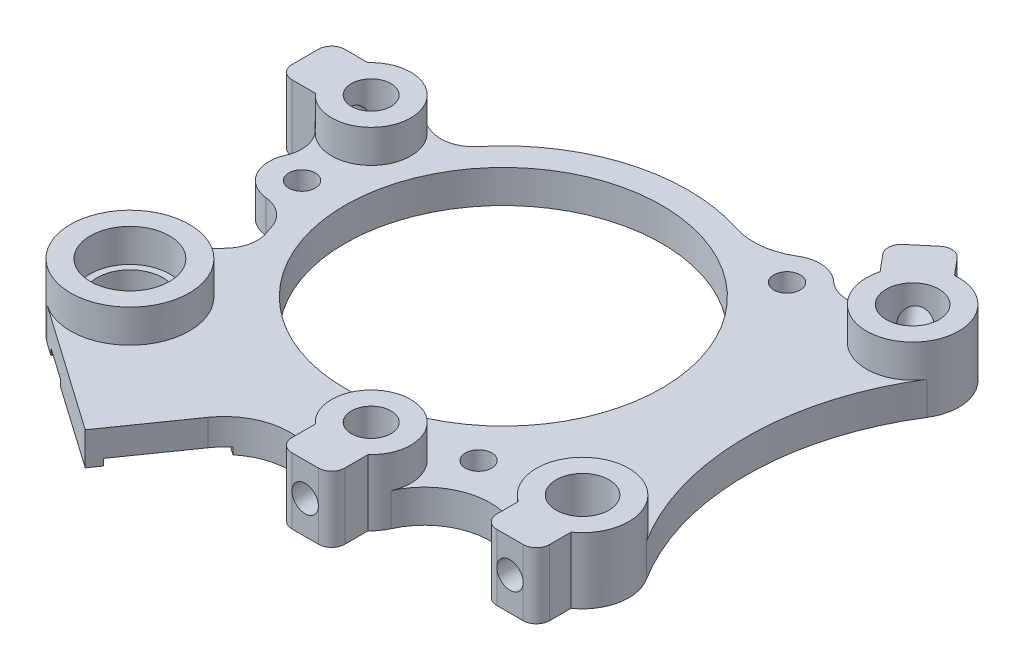
from build123d import *

# Parameters (mm, degrees)
SKETCH1_R               = 2
SKETCH1_R_2             = 3
SKETCH1_R_3             = 24
SKETCH1_R_4             = 4
SKETCH1_R_5             = 6
BOSS_EXTRUDE1_DEPTH     = 5
BOSS_EXTRUDE2_START     = 5
SKETCH2_R               = 6
SKETCH2_R_2             = 3
SKETCH2_R_3             = 9
SKETCH2_R_4             = 7
SKETCH2_R_5             = 4
BOSS_EXTRUDE2_DEPTH     = 5
SKETCH2_3_R             = 6
SKETCH2_3_R_2           = 5
BOSS_EXTRUDE3_DEPTH     = 5
CUT_EXTRUDE1_DEPTH      = 3.5
CUT_EXTRUDE2_START      = -1
SKETCH3_3_R             = 5
CUT_EXTRUDE2_DEPTH      = 1
SKETCH3_4_R             = 1
CUT_EXTRUDE3_DEPTH      = 4.99
BOSS_EXTRUDE4_START     = -10
BOSS_EXTRUDE4_DEPTH     = 10
CUT_EXTRUDE5_REACH      = 100.715
CUT_EXTRUDE5_END_RADIUS = 3
SKETCH5_R               = 2
CUT_EXTRUDE6_REACH      = 85.831
CUT_EXTRUDE6_END_RADIUS = 4
SKETCH8_R               = 2
CUT_EXTRUDE7_REACH      = 74.483
CUT_EXTRUDE7_END_RADIUS = 4
SKETCH7_R               = 2
CUT_EXTRUDE8_REACH      = 90.531
CUT_EXTRUDE8_END_RADIUS = 3
SKETCH6_R               = 2
FILLET1_R               = 10


with BuildPart() as part:
    # Sketch1 → Boss-Extrude1 (new body)
    with BuildSketch(Plane(origin=(0, 0, 0), x_dir=(1, 0, 0), z_dir=(0, 1, 0))):
        with BuildLine():
            Line((-27.184252213, 16.279325281), (-29.427581936, 17.095830526))
            ThreePointArc((-29.427581936, 17.095830526), (-36.458821852, 14.805565694), (-35.926828641, 7.429887354))
            ThreePointArc((-35.926828641, 7.429887354), (-34.695212118, 4.861149883), (-35.066383422, 2.036698907))
            ThreePointArc((-35.066383422, 2.036698907), (-34.820597735, -2.516433033), (-30.981557377, -4.976756222))
            ThreePointArc((-30.981557377, -4.976756222), (-28.317469736, -6.067007919), (-26.695976155, -8.445404498))
            ThreePointArc((-26.695976155, -8.445404498), (-26.517787426, -8.989268605), (-26.328520099, -9.529377177))
            ThreePointArc((-26.328520099, -9.529377177), (-26.149533562, -12.317625103), (-27.49450764, -14.766585578))
            Line((-27.49450764, -14.766585578), (-34.648232278, -21.920310217))
            ThreePointArc((-34.648232278, -21.920310217), (-37.25002353, -29.068672932), (-33.446459175, -35.656639646))
            Line((-33.446459175, -35.656639646), (-14.21846567, -49.120225643))
            Line((-14.21846567, -49.120225643), (-0.916023693, -30.122369648))
            ThreePointArc((-0.916023693, -30.122369648), (3.367217791, -32.328210757), (6.998677081, -35.494343419))
            ThreePointArc((6.998677081, -35.494343419), (12.390762018, -37.40670442), (16.93447098, -33.930152473))
            ThreePointArc((16.93447098, -33.930152473), (23.825671194, -28.267607379), (32.496308957, -30.358802757))
            ThreePointArc((32.496308957, -30.358802757), (41.596573655, -30.279347558), (42.927584732, -21.276595745))
            ThreePointArc((42.927584732, -21.276595745), (36.799497484, 0), (42.927584732, 21.276595745))
            ThreePointArc((42.927584732, 21.276595745), (40.519207625, 31.051047652), (30.832520912, 28.310921578))
            ThreePointArc((30.832520912, 28.310921578), (27.241849474, 25.742680837), (23.016100401, 27.020110539))
            ThreePointArc((23.016100401, 27.020110539), (20.102162754, 28.339579245), (16.984754776, 27.622782358))
            ThreePointArc((16.984754776, 27.622782358), (12.928437353, 26.210002133), (8.653635891, 26.629205506))
            ThreePointArc((8.653635891, 26.629205506), (-7.841377865, 26.879598084), (-21.614431573, 17.7993356))
            ThreePointArc((-21.614431573, 17.7993356), (-24.157783947, 16.154182216), (-27.184252213, 16.279325281))
        make_face()
        with Locations(Location((19.605022095, -23.364355515, 0), (0, 0, 270))):
            Circle(SKETCH1_R, mode=Mode.SUBTRACT)
        with Locations(Location((-30.5, 0, 0), (0, 0, 270))):
            Circle(SKETCH1_R, mode=Mode.SUBTRACT)
        with Locations(Location((-31.479702796, 11.457674801, 0), (0, 0, 270))):
            Circle(SKETCH1_R_2, mode=Mode.SUBTRACT)
        with Locations(Location((0, 0, 0), (0, 0, 270))):
            Circle(SKETCH1_R_3, mode=Mode.SUBTRACT)
        with Locations(Location((19.605022095, 23.364355515, 0), (0, 0, 270))):
            Circle(SKETCH1_R, mode=Mode.SUBTRACT)
        with Locations(Location((37, 25, 0), (0, 0, 270))):
            Circle(SKETCH1_R_4, mode=Mode.SUBTRACT)
        with Locations(Location((-28.284271247, -28.284271247, 0), (0, 0, 270))):
            Circle(SKETCH1_R_5, mode=Mode.SUBTRACT)
        with Locations(Location((37, -25, 0), (0, 0, 270))):
            Circle(SKETCH1_R_4, mode=Mode.SUBTRACT)
        with Locations(Location((11.457674801, -31.479702796, 0), (0, 0, 270))):
            Circle(SKETCH1_R_2, mode=Mode.SUBTRACT)
    extrude(amount=-BOSS_EXTRUDE1_DEPTH)

    # Sketch2 → Boss-Extrude2 (add)
    # profile 1 of 5: a face of its own
    with BuildSketch(Plane(origin=(0, 0, 0), x_dir=(1, 0, 0), z_dir=(0, 1, 0)).offset(BOSS_EXTRUDE2_START)):
        with Locations(Location((-31.479702796, 11.457674801, 0), (0, 0, 270))):
            Circle(SKETCH2_R)
        with Locations(Location((-31.479702796, 11.457674801, 0), (0, 0, 270))):
            Circle(SKETCH2_R_2, mode=Mode.SUBTRACT)
    # profile 2 of 5: a face of its own
    with BuildSketch(Plane(origin=(0, 0, 0), x_dir=(1, 0, 0), z_dir=(0, 1, 0)).offset(BOSS_EXTRUDE2_START)):
        with Locations(Location((-28.284271247, -28.284271247, 0), (0, 0, 270))):
            Circle(SKETCH2_R_3)
        with Locations(Location((-28.284271247, -28.284271247, 0), (0, 0, 270))):
            Circle(SKETCH2_R, mode=Mode.SUBTRACT)
    # profile 3 of 5: a face of its own
    with BuildSketch(Plane(origin=(0, 0, 0), x_dir=(1, 0, 0), z_dir=(0, 1, 0)).offset(BOSS_EXTRUDE2_START)):
        with Locations(Location((37, -25, 0), (0, 0, 270))):
            Circle(SKETCH2_R_4)
        with Locations(Location((37, -25, 0), (0, 0, 270))):
            Circle(SKETCH2_R_5, mode=Mode.SUBTRACT)
    # profile 4 of 5: a face of its own
    with BuildSketch(Plane(origin=(0, 0, 0), x_dir=(1, 0, 0), z_dir=(0, 1, 0)).offset(BOSS_EXTRUDE2_START)):
        with Locations(Location((11.457674801, -31.479702796, 0), (0, 0, 270))):
            Circle(SKETCH2_R)
        with Locations(Location((11.457674801, -31.479702796, 0), (0, 0, 270))):
            Circle(SKETCH2_R_2, mode=Mode.SUBTRACT)
    # profile 5 of 5: a face of its own
    with BuildSketch(Plane(origin=(0, 0, 0), x_dir=(1, 0, 0), z_dir=(0, 1, 0)).offset(BOSS_EXTRUDE2_START)):
        with Locations(Location((37, 25, 0), (0, 0, 270))):
            Circle(SKETCH2_R_4)
        with Locations(Location((37, 25, 0), (0, 0, 270))):
            Circle(SKETCH2_R_5, mode=Mode.SUBTRACT)
    extrude(amount=-BOSS_EXTRUDE2_DEPTH)

    # Sketch2<3> → Boss-Extrude3 (add)
    with BuildSketch(Plane(origin=(0, 0, 0), x_dir=(1, 0, 0), z_dir=(0, 1, 0))):
        with Locations(Location((-28.284271247, -28.284271247, 0), (0, 0, 270))):
            Circle(SKETCH2_3_R)
        with Locations(Location((-28.284271247, -28.284271247, 0), (0, 0, 270))):
            Circle(SKETCH2_3_R_2, mode=Mode.SUBTRACT)
    extrude(amount=-BOSS_EXTRUDE3_DEPTH)

    # Sketch3 → Cut-Extrude1 (cut)
    with BuildSketch(Plane.XZ.offset(5)):
        Polygon((-16.489671847, 45.088360779), (-25.500344334, 38.779019979), (-17.470274225, 27.310891359), (-8.459601738, 33.620232159), align=None)
    extrude(amount=-CUT_EXTRUDE1_DEPTH, mode=Mode.SUBTRACT)

    # Sketch3<3> → Cut-Extrude2 (cut)
    # profile 1 of 2: a face of its own
    with BuildSketch(Plane.XZ.offset(5).offset(CUT_EXTRUDE2_START)):
        with BuildLine():
            Line((-30.4152566, 35.337561361), (-36.933130025, 30.773697256))
            ThreePointArc((-36.933130025, 30.773697256), (-36.998730793, 26.035228154), (-34.648232278, 21.920310217))
            Line((-34.648232278, 21.920310217), (-30.744265011, 18.016342949))
            Line((-30.744265011, 18.016342949), (-22.385186491, 23.869432741))
            Line((-22.385186491, 23.869432741), (-20.721814826, 21.493891813))
            Line((-20.721814826, 21.493891813), (-15.80690256, 24.935350431))
            Line((-15.80690256, 24.935350431), (-26.647497207, 40.417324068))
            Line((-26.647497207, 40.417324068), (-31.562409473, 36.97586545))
            Line((-31.562409473, 36.97586545), (-30.4152566, 35.337561361))
        make_face()
        with Locations(Location((-28.284271247, 28.284271247, 0), (0, 0, 90))):
            Circle(SKETCH3_3_R, mode=Mode.SUBTRACT)
    # profile 2 of 2: a face of its own
    with BuildSketch(Plane.XZ.offset(5).offset(CUT_EXTRUDE2_START)):
        Polygon((-13.071312797, 47.481921554), (-16.489671847, 45.088360779), (-8.459601738, 33.620232159), (-5.041242688, 36.013792934), align=None)
    extrude(amount=CUT_EXTRUDE2_DEPTH, mode=Mode.SUBTRACT)

    # Sketch3<4> → Cut-Extrude3 (cut)
    with BuildSketch(Plane.XZ.offset(5)):
        with Locations(Location((-19.985088002, 25.672077255, 0), (0, 0, 270))):
            Circle(SKETCH3_4_R)
        with Locations(Location((-27.900442824, 36.976375466, 0), (0, 0, 270))):
            Circle(SKETCH3_4_R)
    extrude(amount=-CUT_EXTRUDE3_DEPTH, mode=Mode.SUBTRACT)

    # Boss-Extrude4: read off the stored shape, not the designer's step
    # Boss-Extrude4 outline → Boss-Extrude4 (add)
    with BuildSketch(Plane.XZ.offset(5).offset(BOSS_EXTRUDE4_START)):
        with BuildLine():
            Line((15.457674801, 35.951838751), (15.457674801, 39.479702796))
            ThreePointArc((15.457674801, 39.479702796), (14.871888364, 40.893916359), (13.457674801, 41.479702796))
            Line((13.457674801, 41.479702796), (9.457674801, 41.479702796))
            ThreePointArc((9.457674801, 41.479702796), (8.043461238, 40.893916359), (7.457674801, 39.479702796))
            Line((7.457674801, 39.479702796), (7.457674801, 35.951838751))
            ThreePointArc((7.457674801, 35.951838751), (11.457674801, 37.479702796), (15.457674801, 35.951838751))
        make_face()
        with BuildLine():
            ThreePointArc((33, 30.744562647), (37, 32), (41, 30.744562647))
            Line((41, 30.744562647), (41, 34))
            ThreePointArc((41, 34), (40.414213562, 35.414213562), (39, 36))
            Line((39, 36), (35, 36))
            ThreePointArc((35, 36), (33.585786438, 35.414213562), (33, 34))
            Line((33, 34), (33, 30.744562647))
        make_face()
        with BuildLine():
            Line((30.243288535, -26.829439855), (28.15073374, -29.323249549))
            ThreePointArc((28.15073374, -29.323249549), (27.69043323, -30.783136254), (28.397247407, -32.140913655))
            Line((28.397247407, -32.140913655), (31.46142518, -34.712064094))
            ThreePointArc((31.46142518, -34.712064094), (32.921311885, -35.172364604), (34.279089285, -34.465550427))
            Line((34.279089285, -34.465550427), (36.37164408, -31.971740732))
            ThreePointArc((36.37164408, -31.971740732), (32.500486732, -30.362311102), (30.243288535, -26.829439855))
        make_face()
        with BuildLine():
            ThreePointArc((-35.951838751, -15.457674801), (-37.479702796, -11.457674801), (-35.951838751, -7.457674801))
            Line((-35.951838751, -7.457674801), (-39.479702796, -7.457674801))
            ThreePointArc((-39.479702796, -7.457674801), (-40.893916359, -8.043461238), (-41.479702796, -9.457674801))
            Line((-41.479702796, -9.457674801), (-41.479702796, -13.457674801))
            ThreePointArc((-41.479702796, -13.457674801), (-40.893916359, -14.871888364), (-39.479702796, -15.457674801))
            Line((-39.479702796, -15.457674801), (-35.951838751, -15.457674801))
        make_face()
    extrude(amount=BOSS_EXTRUDE4_DEPTH)

    # Cut-Extrude5: up to this cylinder (the profile starts outside it)
    cut_extrude5_end = Plane(origin=(-31.479702796, 0, -11.457674801), z_dir=(0, 1, 0)) * Cylinder(CUT_EXTRUDE5_END_RADIUS, 208.43, mode=Mode.PRIVATE)
    # Sketch5 → Cut-Extrude5 (cut, up to the surface)
    with BuildSketch(Plane.ZY.offset(41.479702796), mode=Mode.PRIVATE) as cut_extrude5_sk1:
        with Locations((-11.457674801, 0)):
            Circle(SKETCH5_R)
    cut_extrude5_tool1 = extrude(cut_extrude5_sk1.sketch, amount=-CUT_EXTRUDE5_REACH, mode=Mode.PRIVATE) - cut_extrude5_end
    add(cut_extrude5_tool1.solids().sort_by_distance((-41.479703, 0, -11.457675))[0], mode=Mode.SUBTRACT)

    # Cut-Extrude6: up to this cylinder (the profile starts outside it)
    cut_extrude6_end = Plane(origin=(37, 0, 25), z_dir=(0, 1, 0)) * Cylinder(CUT_EXTRUDE6_END_RADIUS, 180.662, mode=Mode.PRIVATE)
    # Sketch8 → Cut-Extrude6 (cut, up to the surface)
    with BuildSketch(Plane.XY.offset(36), mode=Mode.PRIVATE) as cut_extrude6_sk1:
        with Locations((37, 0)):
            Circle(SKETCH8_R)
    cut_extrude6_tool1 = extrude(cut_extrude6_sk1.sketch, amount=-CUT_EXTRUDE6_REACH, mode=Mode.PRIVATE) - cut_extrude6_end
    add(cut_extrude6_tool1.solids().sort_by_distance((37, 0, 36))[0], mode=Mode.SUBTRACT)

    # Cut-Extrude7: up to this cylinder (the profile starts outside it)
    cut_extrude7_end = Plane(origin=(37, 0, -25), z_dir=(0, 1, 0)) * Cylinder(CUT_EXTRUDE7_END_RADIUS, 157.966, mode=Mode.PRIVATE)
    # Sketch7 → Cut-Extrude7 (cut, up to the surface)
    with BuildSketch(Plane(origin=(-4.093251906, 0, -4.878147664), x_dir=(-0.7660444431189798, 0, 0.6427876096865375), z_dir=(-0.6427876096865375, 0, -0.7660444431189798)), mode=Mode.PRIVATE) as cut_extrude7_sk1:
        with Locations((-44.413334638, 0)):
            Circle(SKETCH7_R)
    cut_extrude7_tool1 = extrude(cut_extrude7_sk1.sketch, amount=-CUT_EXTRUDE7_REACH, mode=Mode.PRIVATE) - cut_extrude7_end
    add(cut_extrude7_tool1.solids().sort_by_distance((29.929336, 0, -33.426489))[0], mode=Mode.SUBTRACT)

    # Cut-Extrude8: up to this cylinder (the profile starts outside it)
    cut_extrude8_end = Plane(origin=(11.457674801, 0, 31.479702796), z_dir=(0, 1, 0)) * Cylinder(CUT_EXTRUDE8_END_RADIUS, 188.062, mode=Mode.PRIVATE)
    # Sketch6 → Cut-Extrude8 (cut, up to the surface)
    with BuildSketch(Plane.XY.offset(41.479702796), mode=Mode.PRIVATE) as cut_extrude8_sk1:
        with Locations((11.457674801, 0)):
            Circle(SKETCH6_R)
    cut_extrude8_tool1 = extrude(cut_extrude8_sk1.sketch, amount=-CUT_EXTRUDE8_REACH, mode=Mode.PRIVATE) - cut_extrude8_end
    add(cut_extrude8_tool1.solids().sort_by_distance((11.457675, 0, 41.479703))[0], mode=Mode.SUBTRACT)

    # Fillet1
    # the kernel refuses this fillet: 10 mm, written as the material it adds along each edge
    with BuildSketch(Plane(origin=(-0.916023693, 0, 30.122369648), x_dir=(-0.573576436351044, 0, 0.8191520442889931), z_dir=(0, -1, 0))) as fillet1_piece_1_section:
        with BuildLine():
            CenterArc((9.851293444, -10), FILLET1_R, 90, 87.504443294)
            ThreePointArc((-0.139222568, -9.564580891), (-0.649847133, -4.7738445), (0, 0))
            Line((0, 0), (9.851293444, 0))
        make_face()
    fillet1_piece_1 = extrude(amount=29.628233611, mode=Mode.PRIVATE)
    fillet1_piece_1 = split(fillet1_piece_1, bisect_by=Plane(origin=(-0.916023693, -4, 30.122369648), z_dir=(0, 1, 0)), keep=Keep.TOP, mode=Mode.PRIVATE)
    add(fillet1_piece_1)
    with BuildSketch(Plane(origin=(-0.916023693, 24.628233611, 30.122369648), x_dir=(-0.573576436351044, 0, 0.8191520442889931), z_dir=(0, -1, 0))) as fillet1_piece_2_section:
        with BuildLine():
            CenterArc((9.851293444, -10), FILLET1_R, 90, 87.504443294)
            ThreePointArc((-0.139222568, -9.564580891), (-0.649847133, -4.7738445), (0, 0))
            Line((0, 0), (9.851293444, 0))
        make_face()
    fillet1_piece_2 = extrude(amount=29.628233611, mode=Mode.PRIVATE)
    fillet1_piece_2 = split(fillet1_piece_2, bisect_by=Plane(origin=(-5.041242688, 24.628233611, 36.013792934), z_dir=(0.5735764363510472, 0, -0.819152044288991)), keep=Keep.TOP, mode=Mode.PRIVATE)
    fillet1_piece_2 = split(fillet1_piece_2, bisect_by=Plane(origin=(-0.916023693, -4, 30.122369648), z_dir=(0, -1, 0)), keep=Keep.TOP, mode=Mode.PRIVATE)
    add(fillet1_piece_2)


solid = part.part
